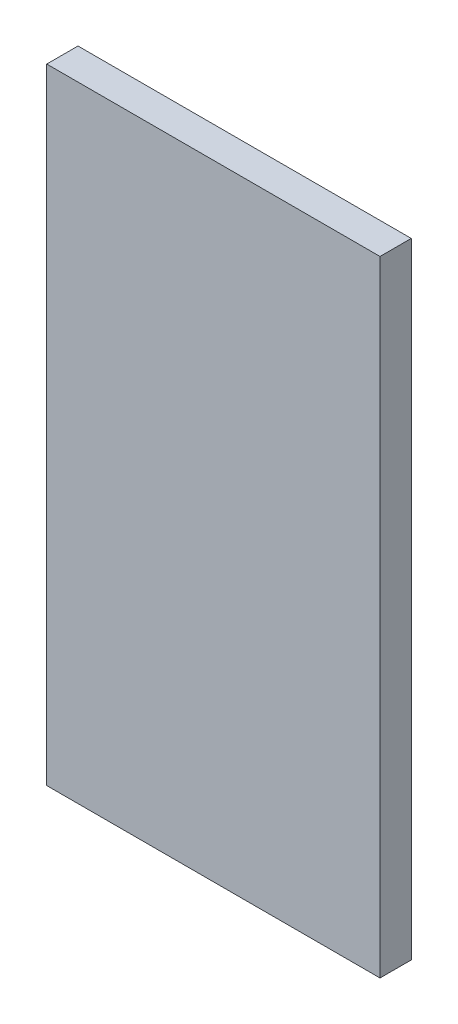
from build123d import *

# Parameters (mm, degrees)
SKETCH_1_W      = 16
SKETCH_1_H      = 30
EXTRUDE_1_DEPTH = 1.5


with BuildPart() as part:
    # Эскиз1 → Бобышка-Вытянуть1 (new body)
    with BuildSketch(Plane.XY):
        with Locations((8, 15)):
            Rectangle(SKETCH_1_W, SKETCH_1_H)
    extrude(amount=EXTRUDE_1_DEPTH)


solid = part.part
